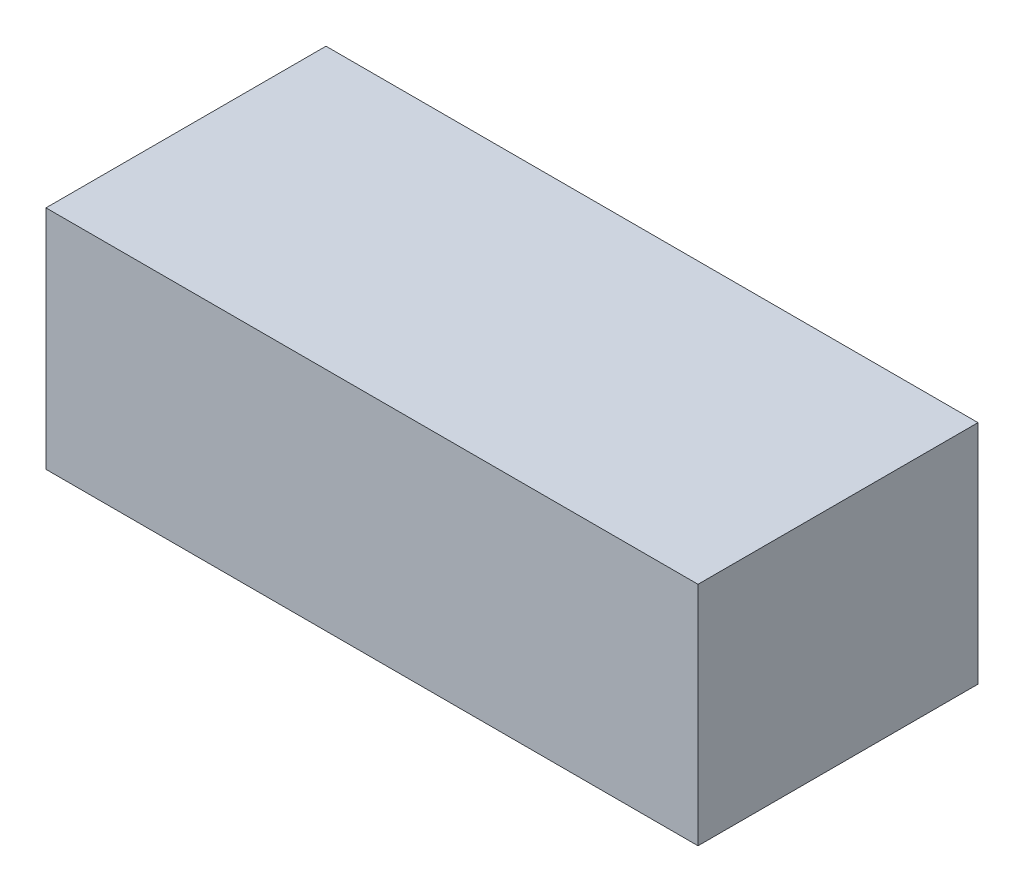
from build123d import *

# Parameters (mm, degrees)
SKETCH1_W           = 43.18
SKETCH1_H           = 18.542
BOSS_EXTRUDE1_DEPTH = 15


with BuildPart() as part:
    # Sketch1 → Boss-Extrude1 (new body)
    with BuildSketch(Plane(origin=(0, 0, 0), x_dir=(1, 0, 0), z_dir=(0, 1, 0))):
        Rectangle(SKETCH1_W, SKETCH1_H)
    extrude(amount=BOSS_EXTRUDE1_DEPTH)


solid = part.part
